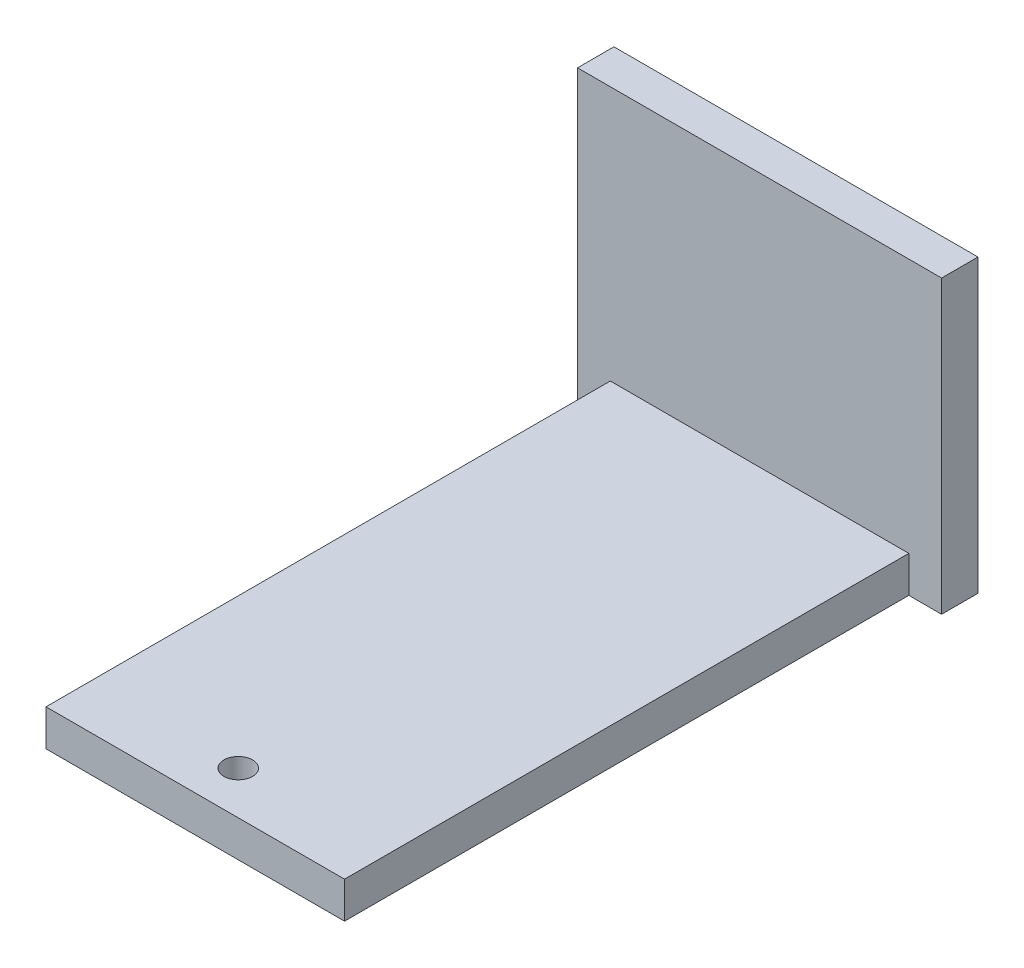
from build123d import *

# Parameters (mm, degrees)
SKETCH1_W           = 25.4
SKETCH1_H           = 25.4
BOSS_EXTRUDE1_DEPTH = 2.54
BOSS_EXTRUDE3_DEPTH = 1.27
SKETCH6_W           = 25.4
SKETCH6_H           = 5.08
CUT_EXTRUDE1_DEPTH  = 56.197537083
SKETCH7_R           = 1
CUT_EXTRUDE2_DEPTH  = 54.051960378


with BuildPart() as part:
    # Sketch1 → Boss-Extrude1 (new body)
    with BuildSketch(Plane.XY):
        with Locations((12.7, -12.7)):
            Rectangle(SKETCH1_W, SKETCH1_H)
    extrude(amount=BOSS_EXTRUDE1_DEPTH)

    # Sketch2 → Boss-Extrude3 (add, symmetric)
    with BuildSketch(Plane(origin=(0, -19.05, 0), x_dir=(1, 0, 0), z_dir=(0, 1, 0))):
        Polygon((2.286, -2.54), (2.286, -41.91), (23.114, -41.91), (23.114, -2.54), (12.7, -2.54), align=None)
    extrude(amount=BOSS_EXTRUDE3_DEPTH, both=True)

    # Sketch6 → Cut-Extrude1 (cut, through all)
    with BuildSketch(Plane.XY.offset(41.91)):
        with Locations((12.7, -22.86)):
            Rectangle(SKETCH6_W, SKETCH6_H)
    extrude(amount=-CUT_EXTRUDE1_DEPTH, mode=Mode.SUBTRACT)

    # Sketch7 → Cut-Extrude2 (cut, through all)
    with BuildSketch(Plane(origin=(0, -20.32, 0), x_dir=(-1, 0, 0), z_dir=(0, -1, 0))):
        with Locations((-12.7, -38.91)):
            Circle(SKETCH7_R)
    extrude(amount=-CUT_EXTRUDE2_DEPTH, mode=Mode.SUBTRACT)


solid = part.part
